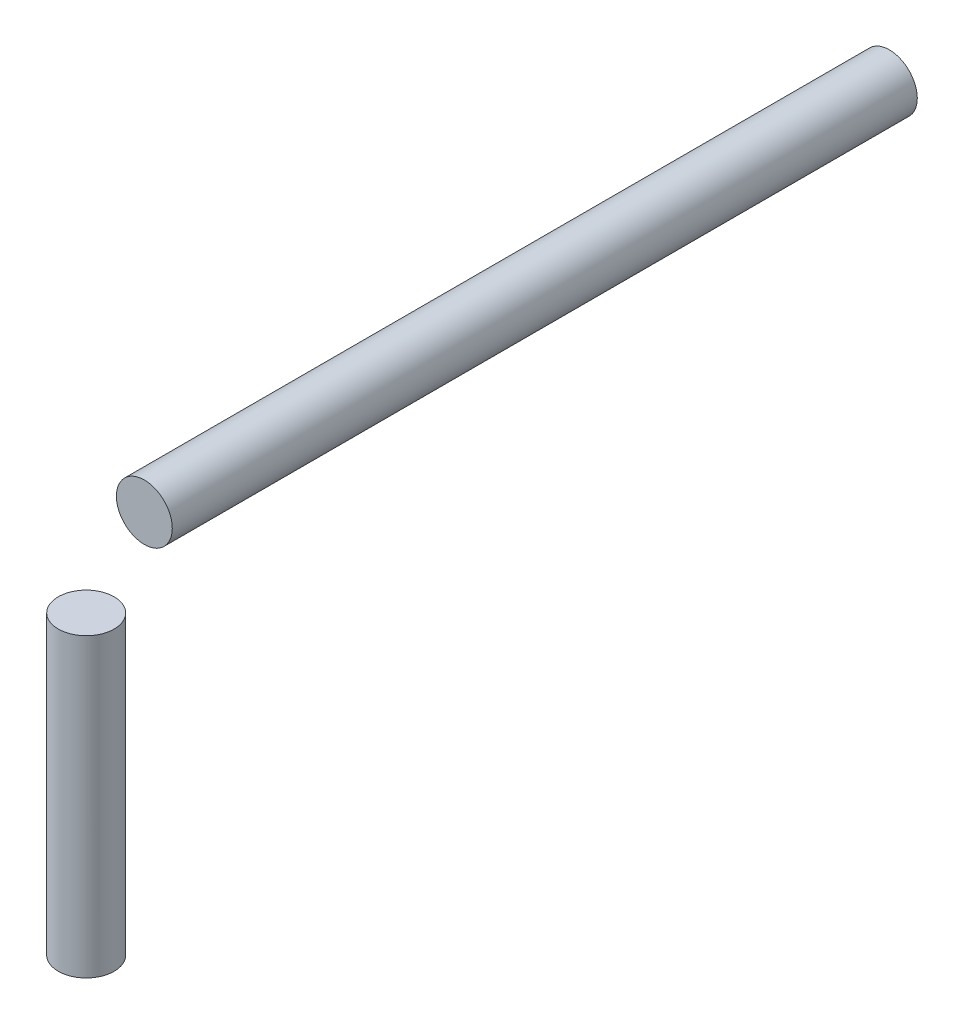
from build123d import *

# Parameters (mm, degrees)
BOSS_EXTRUDE1_START     = -169.27068
BOSS_EXTRUDE1_OUTLINE_R = 6.35
BOSS_EXTRUDE1_DEPTH     = 169.27068
SKETCH3_R               = 6.35
BOSS_EXTRUDE2_DEPTH     = 67.351244111


# Read off the part's stored shape, not the designer's step: Boss-Extrude1
with BuildPart() as part:
    # Boss-Extrude1 outline → Boss-Extrude1 (new body)
    with BuildSketch(Plane.XY.offset(146.41068).offset(BOSS_EXTRUDE1_START)):
        with Locations((-36.068, 0)):
            Circle(BOSS_EXTRUDE1_OUTLINE_R)
    extrude(amount=BOSS_EXTRUDE1_DEPTH)


with BuildPart() as body_2:
    # Sketch3 → Boss-Extrude2 (new body)
    with BuildSketch(Plane(origin=(0, -13.208, 0), x_dir=(-1, 0, 0), z_dir=(0, -1, 0))):
        with Locations(Location((36.068, -159.61868, 0), (0, 0, 270))):
            Circle(SKETCH3_R)
    extrude(amount=BOSS_EXTRUDE2_DEPTH)


solid = Compound([part.part, body_2.part])
